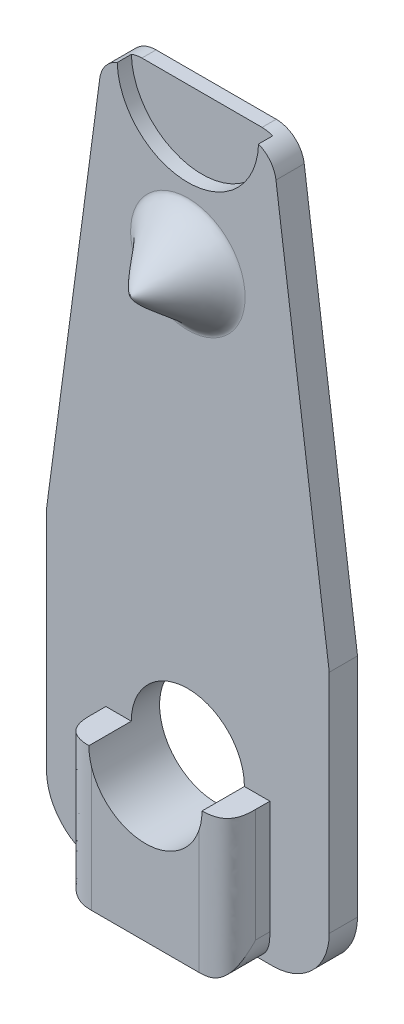
from build123d import *

# Parameters (mm, degrees)
BOSS_EXTRUDE1_DEPTH     = 1
SKETCH4_W               = 5.8
SKETCH4_H               = 5
BOSS_EXTRUDE2_DEPTH     = 1.5
CUT_EXTRUDE2_DEPTH      = 19.875882218
CUT_EXTRUDE2_DEPTH_BACK = 19.875882218
SKETCH3_R               = 2
FILLET2_SIZE            = 1
SKETCH11_R              = 2.5
CUT_EXTRUDE4_DEPTH      = 0.5


with BuildPart() as part:
    # Sketch1 → Boss-Extrude1 (new body)
    with BuildSketch(Plane.XY):
        with BuildLine():
            Line((-3, -6.860294118), (3, -6.860294118))
            ThreePointArc((3, -6.860294118), (4.414213562, -6.27450768), (5, -4.860294118))
            Line((5, -4.860294118), (5, 3.139705882))
            Line((5, 3.139705882), (3.115711504, 17.271869602))
            ThreePointArc((3.115711504, 17.271869602), (2.783208235, 17.89209), (2.124483603, 18.139705882))
            Line((2.124483603, 18.139705882), (-2.124483603, 18.139705882))
            ThreePointArc((-2.124483603, 18.139705882), (-2.783208235, 17.89209), (-3.115711504, 17.271869602))
            Line((-3.115711504, 17.271869602), (-5, 3.139705882))
            Line((-5, 3.139705882), (-5, -4.860294118))
            ThreePointArc((-5, -4.860294118), (-4.414213562, -6.27450768), (-3, -6.860294118))
        make_face()
    extrude(amount=BOSS_EXTRUDE1_DEPTH)

    # Sketch4 → Boss-Extrude2 (add)
    with BuildSketch(Plane.XY.offset(1)):
        with Locations((0, -4.360294118)):
            Rectangle(SKETCH4_W, SKETCH4_H)
    extrude(amount=BOSS_EXTRUDE2_DEPTH)

    # Sketch3 → Cut-Extrude2 (cut, two sides: drawn at the far end of the back side and taken through both)
    with BuildSketch(Plane.XY.offset(1).offset(-CUT_EXTRUDE2_DEPTH_BACK)):
        with Locations((0, -1.860294118)):
            Circle(SKETCH3_R)
    extrude(amount=CUT_EXTRUDE2_DEPTH + CUT_EXTRUDE2_DEPTH_BACK, mode=Mode.SUBTRACT)

    # Sketch10 → Revolve1 (revolve)
    with BuildSketch(Plane.ZY):
        with BuildLine():
            Line((3, 13.139705882), (1, 13.139705882))
            Line((1, 13.139705882), (1, 15.164832594))
            add(Edge.make_bspline(
                [(1, 15.164832594), (1.003638123, 14.768281169), (2.909332007, 13.597450134), (3, 13.139705882)],
                knots=[0, 0, 0, 0, 1, 1, 1, 1], degree=3))
        make_face()
    revolve(axis=Axis((0, 13.139705882, 3), (0, 0, -1)))

    # Fillet2
    # a fillet whose section is not a circle: 1 mm, written as the material it takes off along each edge
    with BuildSketch(Plane(origin=(2.9, -9.360294118, 2.5), x_dir=(0, 0, -1), z_dir=(0, 1, 0)), Plane(origin=(-2.9, 0.639705882, 2.5), x_dir=(0, 0, -1), z_dir=(0, -1, 0))) as fillet2_piece_1:
        with BuildLine():
            add(Edge.make_bspline([(FILLET2_SIZE, 0), (FILLET2_SIZE * 0.831801948466, 0), (FILLET2_SIZE * 0.663603896932, 0), (FILLET2_SIZE * 0.292893218813, FILLET2_SIZE * 0.0716919198361), (FILLET2_SIZE * 0.0716919198361, FILLET2_SIZE * 0.292893218813), (0, FILLET2_SIZE * 0.663603896932), (0, FILLET2_SIZE * 0.831801948466), (0, FILLET2_SIZE)], knots=[0, 0, 0, 0, 0, 0, 0.5, 0.5, 1, 1, 1, 1, 1, 1], degree=5))
            Line((0, FILLET2_SIZE), (0, 0))
            Line((0, 0), (FILLET2_SIZE, 0))
        make_face()
    fillet2_piece_1_solid = extrude(amount=10, mode=Mode.PRIVATE)
    with BuildSketch(Plane(origin=(2.9, -6.860294118, 1), x_dir=(-1, 0, 0), z_dir=(0, 0, 1))) as fillet2_piece_2:
        with BuildLine():
            add(Edge.make_bspline([(FILLET2_SIZE, 0), (FILLET2_SIZE * 0.831801948466, 0), (FILLET2_SIZE * 0.663603896932, 0), (FILLET2_SIZE * 0.292893218813, -FILLET2_SIZE * 0.0716919198361), (FILLET2_SIZE * 0.0716919198361, -FILLET2_SIZE * 0.292893218813), (0, -FILLET2_SIZE * 0.663603896932), (0, -FILLET2_SIZE * 0.831801948466), (0, -FILLET2_SIZE)], knots=[0, 0, 0, 0, 0, 0, 0.5, 0.5, 1, 1, 1, 1, 1, 1], degree=5))
            Line((0, -FILLET2_SIZE), (0, 0))
            Line((0, 0), (FILLET2_SIZE, 0))
        make_face()
    fillet2_piece_2_solid = extrude(amount=4, mode=Mode.PRIVATE)
    with BuildSketch(Plane(origin=(-2.9, -6.860294118, 1), x_dir=(1, 0, 0), z_dir=(0, 0, 1))) as fillet2_piece_3:
        with BuildLine():
            add(Edge.make_bspline([(FILLET2_SIZE, 0), (FILLET2_SIZE * 0.831801948466, 0), (FILLET2_SIZE * 0.663603896932, 0), (FILLET2_SIZE * 0.292893218813, FILLET2_SIZE * 0.0716919198361), (FILLET2_SIZE * 0.0716919198361, FILLET2_SIZE * 0.292893218813), (0, FILLET2_SIZE * 0.663603896932), (0, FILLET2_SIZE * 0.831801948466), (0, FILLET2_SIZE)], knots=[0, 0, 0, 0, 0, 0, 0.5, 0.5, 1, 1, 1, 1, 1, 1], degree=5))
            Line((0, FILLET2_SIZE), (0, 0))
            Line((0, 0), (FILLET2_SIZE, 0))
        make_face()
    fillet2_piece_3_solid = extrude(amount=4, mode=Mode.PRIVATE)
    add([fillet2_piece_1_solid, fillet2_piece_2_solid, fillet2_piece_3_solid], mode=Mode.SUBTRACT)

    # Sketch11 → Cut-Extrude4 (cut)
    with BuildSketch(Plane.XY.offset(1)):
        with Locations((0, 18.139705882)):
            Circle(SKETCH11_R)
    extrude(amount=-CUT_EXTRUDE4_DEPTH, mode=Mode.SUBTRACT)


solid = part.part
